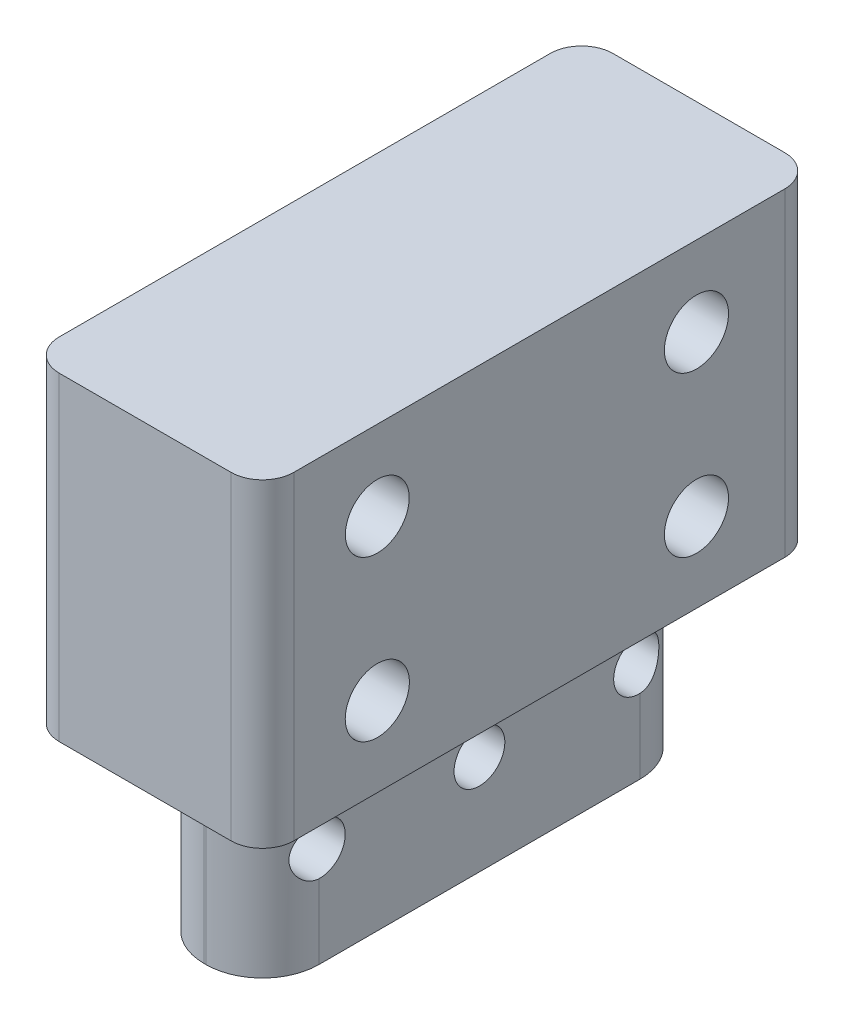
from build123d import *

# Parameters (mm, degrees)
SKETCH1_W           = 18.669
SKETCH1_H           = 50.8
BOSS_EXTRUDE1_DEPTH = 44.069
SKETCH2_W           = 44.069
SKETCH2_H           = 4.7625
CUT_EXTRUDE1_DEPTH  = 70.794328724
SKETCH3_W           = 44.069
SKETCH3_H           = 14.29004
CUT_EXTRUDE2_DEPTH  = 4.7625
SKETCH5_W           = 44.069
SKETCH5_H           = 14.29004
CUT_EXTRUDE3_DEPTH  = 4.7625
SKETCH4_W           = 18.669
SKETCH4_H           = 14.29004
CUT_EXTRUDE4_DEPTH  = 4.7625
SKETCH6_W           = 18.669
SKETCH6_H           = 14.29004
CUT_EXTRUDE5_DEPTH  = 4.7625
FILLET1_R           = 4.50088
FILLET2_R           = 2.49936
SKETCH7_R           = 2.5527
SKETCH7_R_2         = 2.54
CUT_EXTRUDE6_DEPTH  = 70.794328724
SKETCH8_R           = 2.0193
CUT_EXTRUDE7_DEPTH  = 69.673921566
SKETCH10_W          = 18.669
SKETCH10_H          = 6.35
CUT_EXTRUDE8_DEPTH  = 70.794328724


with BuildPart() as part:
    # Sketch1 → Boss-Extrude1 (new body)
    with BuildSketch(Plane.XY):
        with Locations((9.3345, 25.4)):
            Rectangle(SKETCH1_W, SKETCH1_H)
    extrude(amount=BOSS_EXTRUDE1_DEPTH)

    # Sketch2 → Cut-Extrude1 (cut, through all)
    with BuildSketch(Plane(origin=(18.669, 0, 0), x_dir=(0, 0, -1), z_dir=(1, 0, 0))):
        with Locations((-22.0345, 2.38125)):
            Rectangle(SKETCH2_W, SKETCH2_H)
    extrude(amount=-CUT_EXTRUDE1_DEPTH, mode=Mode.SUBTRACT)

    # Sketch3 → Cut-Extrude2 (cut)
    with BuildSketch(Plane(origin=(18.669, 0, 0), x_dir=(0, 0, -1), z_dir=(1, 0, 0))):
        with Locations((-22.0345, 11.90752)):
            Rectangle(SKETCH3_W, SKETCH3_H)
    extrude(amount=-CUT_EXTRUDE2_DEPTH, mode=Mode.SUBTRACT)

    # Sketch5 → Cut-Extrude3 (cut)
    with BuildSketch(Plane.ZY):
        with Locations((22.0345, 11.90752)):
            Rectangle(SKETCH5_W, SKETCH5_H)
    extrude(amount=-CUT_EXTRUDE3_DEPTH, mode=Mode.SUBTRACT)

    # Sketch4 → Cut-Extrude4 (cut)
    with BuildSketch(Plane.XY.offset(44.069)):
        with Locations((9.3345, 11.90752)):
            Rectangle(SKETCH4_W, SKETCH4_H)
    extrude(amount=-CUT_EXTRUDE4_DEPTH, mode=Mode.SUBTRACT)

    # Sketch6 → Cut-Extrude5 (cut)
    with BuildSketch(Plane(origin=(0, 0, 0), x_dir=(-1, 0, 0), z_dir=(0, 0, -1))):
        with Locations((-9.3345, 11.90752)):
            Rectangle(SKETCH6_W, SKETCH6_H)
    extrude(amount=-CUT_EXTRUDE5_DEPTH, mode=Mode.SUBTRACT)

    # Fillet1
    fillet1_edges = [part.edges().sort_by_distance(p)[0] for p in [
        (4.7625, 11.90752, 39.3065),
        (13.9065, 11.90752, 39.3065),
        (4.7625, 11.90752, 4.7625),
        (13.9065, 11.90752, 4.7625),
    ]]
    fillet(fillet1_edges, radius=FILLET1_R)

    # Fillet2
    fillet2_edges = [part.edges().sort_by_distance(p)[0] for p in [
        (0, 34.92627, 44.069),
        (18.669, 34.92627, 44.069),
        (18.669, 34.92627, 0),
        (0, 34.92627, 0),
    ]]
    fillet(fillet2_edges, radius=FILLET2_R)

    # Sketch7 → Cut-Extrude6 (cut, through all)
    with BuildSketch(Plane.ZY):
        with Locations((9.52588, 38.1)):
            Circle(SKETCH7_R)
        with Locations((34.92588, 38.1)):
            Circle(SKETCH7_R_2)
        with Locations((34.92588, 25.4)):
            Circle(SKETCH7_R)
        with Locations((9.52588, 25.4)):
            Circle(SKETCH7_R)
    extrude(amount=-CUT_EXTRUDE6_DEPTH, mode=Mode.SUBTRACT)

    # Sketch8 → Cut-Extrude7 (cut, through all)
    with BuildSketch(Plane.ZY.offset(-4.7625)):
        with Locations((22.03538, 12.7)):
            Circle(SKETCH8_R)
        with Locations((34.73538, 12.7)):
            Circle(SKETCH8_R)
        with Locations((9.33538, 12.7)):
            Circle(SKETCH8_R)
    extrude(amount=-CUT_EXTRUDE7_DEPTH, mode=Mode.SUBTRACT)

    # Sketch10 → Cut-Extrude8 (cut, through all)
    with BuildSketch(Plane(origin=(0, 0, 0), x_dir=(-1, 0, 0), z_dir=(0, 0, -1))):
        with Locations((-9.3345, 47.625)):
            Rectangle(SKETCH10_W, SKETCH10_H)
    extrude(amount=-CUT_EXTRUDE8_DEPTH, mode=Mode.SUBTRACT)


solid = part.part
